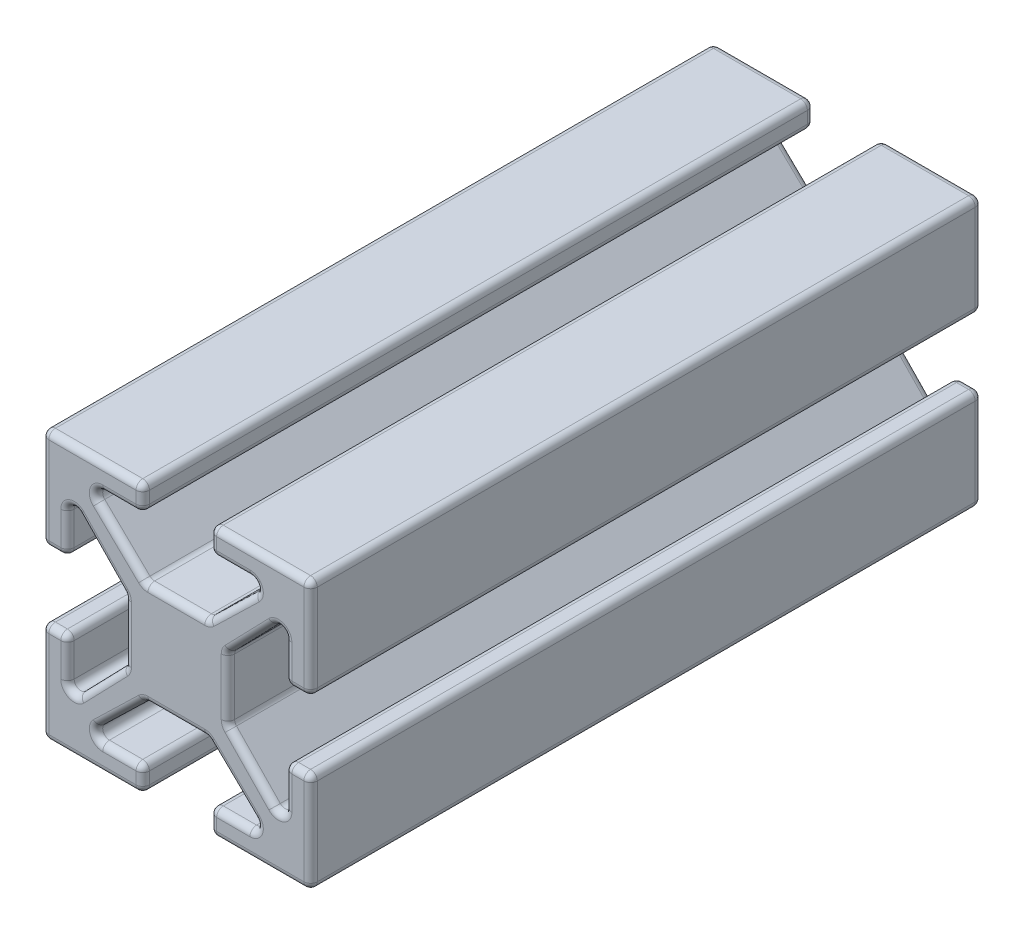
from build123d import *

# Parameters (mm, degrees)
BOSS_EXTRUDE1_DEPTH = 100
FILLET3_R           = 1


with BuildPart() as part:
    # Sketch1 → Boss-Extrude1 (new body)
    with BuildSketch(Plane.XY):
        Polygon((-5, 16.212568099), (-5, 20), (-20, 20), (-20, 5), (-16.212568099, 5), (-16.212568099, 13.432263719), (-7.689389441, 4.631155322), (-7.689389441, 0), (-7.689389441, -4.631155322), (-16.212568099, -13.432263719), (-16.212568099, -5), (-20, -5), (-20, -20), (-5, -20), (-5, -16.212568099), (-13.432263719, -16.212568099), (-4.631155322, -7.689389441), (0, -7.689389441), (4.631155322, -7.689389441), (13.432263719, -16.212568099), (5, -16.212568099), (5, -20), (20, -20), (20, -5), (16.212568099, -5), (16.212568099, -13.432263719), (7.689389441, -4.631155322), (7.689389441, 0), (7.689389441, 4.631155322), (16.212568099, 13.432263719), (16.212568099, 5), (20, 5), (20, 20), (5, 20), (5, 16.212568099), (13.432263719, 16.212568099), (4.631155322, 7.689389441), (0, 7.689389441), (-4.631155322, 7.689389441), (-13.432263719, 16.212568099), align=None)
    extrude(amount=BOSS_EXTRUDE1_DEPTH)

    # Fillet3
    fillet3_edges = [part.edges().sort_by_distance(p)[0] for p in [
        (-9.03170952, -11.95097877, 0),
        (0, -7.689389441, 0),
        (9.031709521, -11.95097877, 0),
        (9.216131859, -16.212568099, 0),
        (5, -18.10628405, 0),
        (12.5, -20, 0),
        (20, -12.5, 0),
        (18.10628405, -5, 0),
        (16.212568099, -9.216131859, 0),
        (11.95097877, -9.03170952, 0),
        (7.689389441, 0, 0),
        (11.95097877, 9.03170952, 0),
        (16.212568099, 9.216131859, 0),
        (18.10628405, 5, 0),
        (20, 12.5, 0),
        (5, 18.10628405, 0),
        (9.216131859, 16.212568099, 0),
        (9.03170952, 11.95097877, 0),
        (0, 7.689389441, 0),
        (-9.03170952, 11.95097877, 0),
        (-9.216131859, 16.212568099, 0),
        (-5, 18.10628405, 0),
        (-12.5, 20, 0),
        (-20, 12.5, 0),
        (-18.10628405, 5, 0),
        (-16.212568099, 9.216131859, 0),
        (-11.95097877, 9.03170952, 0),
        (-7.689389441, 0, 0),
        (-11.95097877, -9.03170952, 0),
        (-16.212568099, -9.216131859, 0),
        (-18.10628405, -5, 0),
        (-20, -12.5, 0),
        (-12.5, -20, 0),
        (-5, -18.10628405, 0),
        (-9.216131859, -16.212568099, 0),
        (-9.03170952, -11.95097877, 100),
        (0, -7.689389441, 100),
        (9.031709521, -11.95097877, 100),
        (9.216131859, -16.212568099, 100),
        (5, -18.10628405, 100),
        (12.5, -20, 100),
        (20, -12.5, 100),
        (18.10628405, -5, 100),
        (16.212568099, -9.216131859, 100),
        (11.95097877, -9.03170952, 100),
        (7.689389441, 0, 100),
        (11.95097877, 9.03170952, 100),
        (16.212568099, 9.216131859, 100),
        (18.10628405, 5, 100),
        (20, 12.5, 100),
        (12.5, 20, 100),
        (5, 18.10628405, 100),
        (9.216131859, 16.212568099, 100),
        (9.03170952, 11.95097877, 100),
        (0, 7.689389441, 100),
        (-9.03170952, 11.95097877, 100),
        (-9.216131859, 16.212568099, 100),
        (-5, 18.10628405, 100),
        (-12.5, 20, 100),
        (-20, 12.5, 100),
        (-18.10628405, 5, 100),
        (-16.212568099, 9.216131859, 100),
        (-11.95097877, 9.03170952, 100),
        (-7.689389441, 0, 100),
        (-11.95097877, -9.03170952, 100),
        (-16.212568099, -9.216131859, 100),
        (-18.10628405, -5, 100),
        (-20, -12.5, 100),
        (-12.5, -20, 100),
        (-5, -18.10628405, 100),
        (-9.216131859, -16.212568099, 100),
        (-13.432263719, -16.212568099, 50),
        (-5, -16.212568099, 50),
        (-5, -20, 50),
        (-20, -20, 50),
        (-20, -5, 50),
        (-16.212568099, -5, 50),
        (-16.212568099, -13.432263719, 50),
        (-7.689389441, -4.631155322, 50),
        (-7.689389441, 4.631155322, 50),
        (-16.212568099, 13.432263719, 50),
        (-16.212568099, 5, 50),
        (-20, 5, 50),
        (-20, 20, 50),
        (-5, 20, 50),
        (-5, 16.212568099, 50),
        (-13.432263719, 16.212568099, 50),
        (-4.631155322, 7.689389441, 50),
        (4.631155322, 7.689389441, 50),
        (13.432263719, 16.212568099, 50),
        (5, 16.212568099, 50),
        (5, 20, 50),
        (20, 20, 50),
        (20, 5, 50),
        (16.212568099, 5, 50),
        (16.212568099, 13.432263719, 50),
        (7.689389441, 4.631155322, 50),
        (7.689389441, -4.631155322, 50),
        (16.212568099, -13.432263719, 50),
        (16.212568099, -5, 50),
        (20, -5, 50),
        (20, -20, 50),
        (5, -20, 50),
        (5, -16.212568099, 50),
        (13.432263719, -16.212568099, 50),
        (4.631155322, -7.689389441, 50),
        (-4.631155322, -7.689389441, 50),
        (12.5, 20, 0),
    ]]
    fillet(fillet3_edges, radius=FILLET3_R)


solid = part.part
